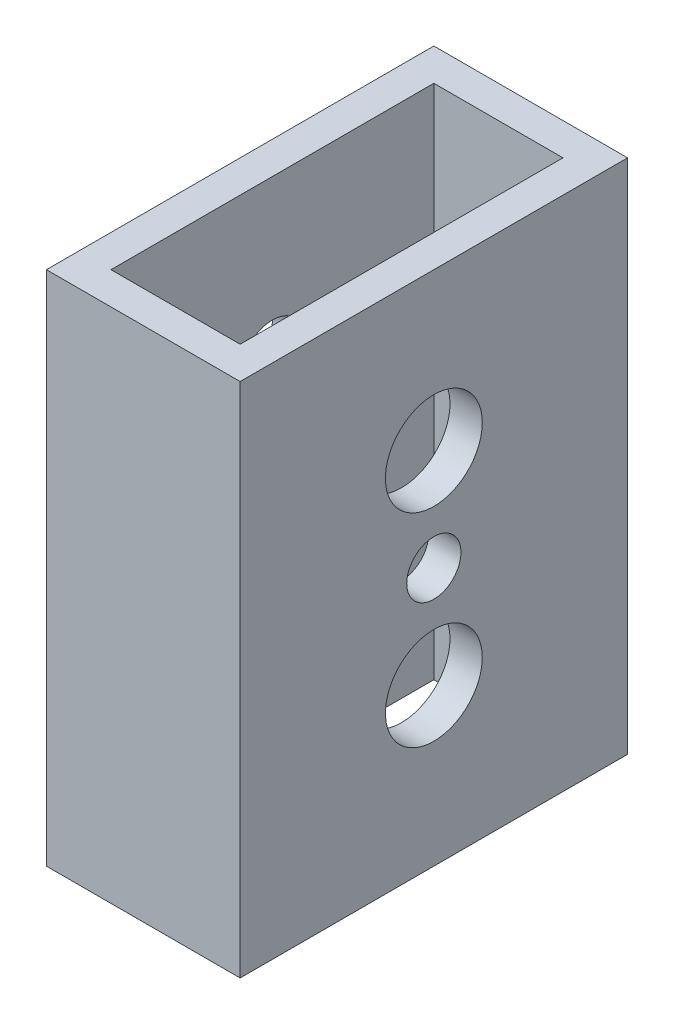
from build123d import *

# Parameters (mm, degrees)
SKETCH1_W           = 19.05
SKETCH1_H           = 38.1
SKETCH1_W_2         = 12.7
SKETCH1_H_2         = 31.75
BOSS_EXTRUDE1_DEPTH = 50.8
SKETCH2_R           = 3.175
CUT_EXTRUDE1_DEPTH  = 67.295946332
CUT_EXTRUDE2_REACH  = 68.296
SKETCH3_R           = 4.7625
SKETCH4_R           = 2.667
CUT_EXTRUDE3_DEPTH  = 67.295946332
CUT_EXTRUDE4_REACH  = 68.296
SKETCH5_R           = 4.7625


with BuildPart() as part:
    # Sketch1 → Boss-Extrude1 (new body)
    with BuildSketch(Plane(origin=(0, 0, 0), x_dir=(1, 0, 0), z_dir=(0, 1, 0))):
        with Locations((9.525, 19.05)):
            Rectangle(SKETCH1_W, SKETCH1_H)
        with Locations((9.525, 19.05)):
            Rectangle(SKETCH1_W_2, SKETCH1_H_2, mode=Mode.SUBTRACT)
    extrude(amount=BOSS_EXTRUDE1_DEPTH)

    # Sketch2 → Cut-Extrude1 (cut, through all)
    with BuildSketch(Plane(origin=(19.05, 0, 0), x_dir=(0, 0, -1), z_dir=(1, 0, 0))):
        with Locations((19.05, 15.40002)):
            Circle(SKETCH2_R)
        with Locations((19.05, 35.39998)):
            Circle(SKETCH2_R)
    extrude(amount=-CUT_EXTRUDE1_DEPTH, mode=Mode.SUBTRACT)

    # Sketch3 → Cut-Extrude2 (cut, up to next)
    with BuildSketch(Plane(origin=(19.05, 0, 0), x_dir=(0, 0, -1), z_dir=(1, 0, 0)), mode=Mode.PRIVATE) as cut_extrude2_sk1:
        with Locations((19.05, 15.40002)):
            Circle(SKETCH3_R)
    cut_extrude2_tool1 = extrude(cut_extrude2_sk1.sketch, amount=-CUT_EXTRUDE2_REACH, mode=Mode.PRIVATE) & part.part
    # Sketch3 → Cut-Extrude2 (cut, up to next)
    with BuildSketch(Plane(origin=(19.05, 0, 0), x_dir=(0, 0, -1), z_dir=(1, 0, 0)), mode=Mode.PRIVATE) as cut_extrude2_sk2:
        with Locations((19.05, 35.39998)):
            Circle(SKETCH3_R)
    cut_extrude2_tool2 = extrude(cut_extrude2_sk2.sketch, amount=-CUT_EXTRUDE2_REACH, mode=Mode.PRIVATE) & part.part
    add(cut_extrude2_tool1.solids().sort_by_distance((19.05, 15.40002, -19.05))[0], mode=Mode.SUBTRACT)
    add(cut_extrude2_tool2.solids().sort_by_distance((19.05, 35.39998, -19.05))[0], mode=Mode.SUBTRACT)

    # Sketch4 → Cut-Extrude3 (cut, through all)
    with BuildSketch(Plane.ZY):
        with Locations((-19.05, 25.4)):
            Circle(SKETCH4_R)
    extrude(amount=-CUT_EXTRUDE3_DEPTH, mode=Mode.SUBTRACT)

    # Sketch5 → Cut-Extrude4 (cut, up to next)
    with BuildSketch(Plane.ZY, mode=Mode.PRIVATE) as cut_extrude4_sk1:
        with Locations((-19.05, 25.4)):
            Circle(SKETCH5_R)
    cut_extrude4_tool1 = extrude(cut_extrude4_sk1.sketch, amount=-CUT_EXTRUDE4_REACH, mode=Mode.PRIVATE) & part.part
    add(cut_extrude4_tool1.solids().sort_by_distance((0, 25.4, -19.05))[0], mode=Mode.SUBTRACT)


solid = part.part
